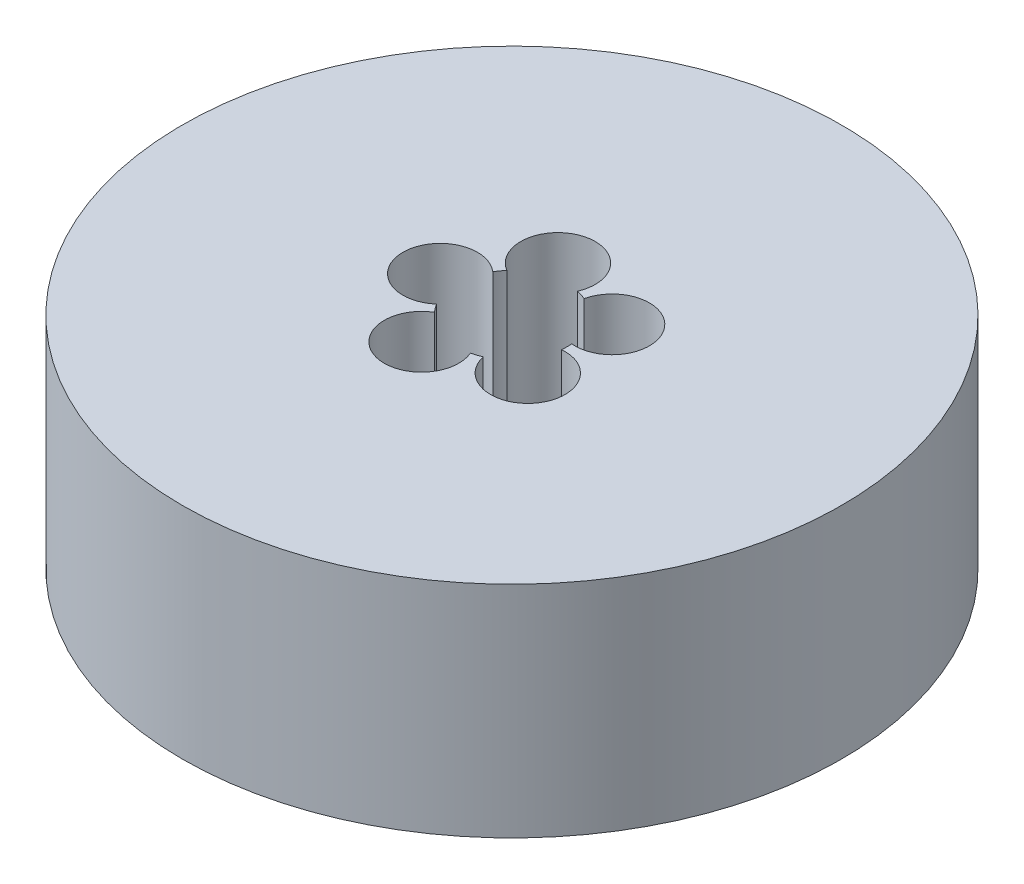
from build123d import *

# Parameters (mm, degrees)
SKETCH1_R           = 45
BOSS_EXTRUDE1_DEPTH = 30
SKETCH2_R           = 7.5
CUT_EXTRUDE1_DEPTH  = 71.356236397
SKETCH3_R           = 5.086810486
CUT_EXTRUDE2_DEPTH  = 26.681945259
CIRPATTERN1_COUNT   = 5


with BuildPart() as part:
    # Sketch1 → Boss-Extrude1 (new body)
    with BuildSketch(Plane(origin=(0, 0, 0), x_dir=(1, 0, 0), z_dir=(0, 1, 0))):
        Circle(SKETCH1_R)
    extrude(amount=BOSS_EXTRUDE1_DEPTH)

    # Sketch2 → Cut-Extrude1 (cut, through all)
    with BuildSketch(Plane(origin=(0, 0, 0), x_dir=(1, 0, 0), z_dir=(0, 1, 0))):
        Circle(SKETCH2_R)
    extrude(amount=CUT_EXTRUDE1_DEPTH, mode=Mode.SUBTRACT)

    # Sketch3 → Cut-Extrude2 (cut)
    with BuildSketch(Plane(origin=(0, 30, 0), x_dir=(1, 0, 0), z_dir=(0, 1, 0))):
        with Locations((-9.797054354, 0)):
            Circle(SKETCH3_R)
    cut_extrude2 = extrude(amount=-CUT_EXTRUDE2_DEPTH, mode=Mode.SUBTRACT)

    # CirPattern1: Cut-Extrude2 ×5 about axis
    cirpattern1_axis = Axis((0, 0, 0), (0, 1, 0))
    for i in range(1, CIRPATTERN1_COUNT):
        add(cut_extrude2.rotate(cirpattern1_axis, i * 360 / CIRPATTERN1_COUNT), mode=Mode.SUBTRACT)


solid = part.part
